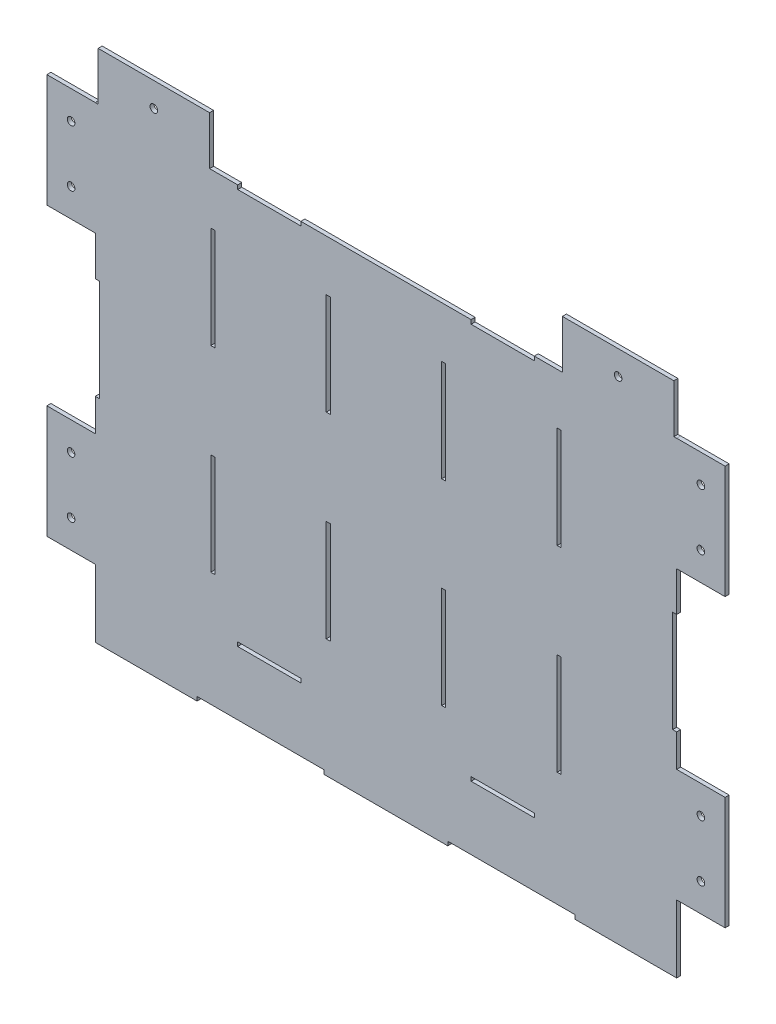
from build123d import *

# Parameters (mm, degrees)
SKETCH1_W                 = 457.223
SKETCH1_H                 = 367.60800004
BOSS_EXTRUDE2_DEPTH       = 3.175
SKETCH4_W                 = 3.175
SKETCH4_H                 = 80
CUT_EXTRUDE1_DEPTH        = 3.175
LPATTERN1_COPY_1_SKETCH_W = 3.175
LPATTERN1_COPY_1_SKETCH_H = 80
LPATTERN1_COPY_1_DEPTH    = 3.175
LPATTERN1_COPY_2_SKETCH_W = 3.175
LPATTERN1_COPY_2_SKETCH_H = 80
LPATTERN1_COPY_2_DEPTH    = 3.175
LPATTERN1_COPY_3_SKETCH_W = 3.175
LPATTERN1_COPY_3_SKETCH_H = 80
LPATTERN1_COPY_3_DEPTH    = 3.175
LPATTERN1_COPY_4_SKETCH_W = 3.175
LPATTERN1_COPY_4_SKETCH_H = 80
LPATTERN1_COPY_4_DEPTH    = 3.175
LPATTERN1_COPY_5_SKETCH_W = 3.175
LPATTERN1_COPY_5_SKETCH_H = 80
LPATTERN1_COPY_5_DEPTH    = 3.175
LPATTERN1_COPY_6_SKETCH_W = 3.175
LPATTERN1_COPY_6_SKETCH_H = 80
LPATTERN1_COPY_6_DEPTH    = 3.175
SKETCH5_W                 = 49.658811606
SKETCH5_H                 = 3.175
CUT_EXTRUDE2_DEPTH        = 3.175
MIRROR3_COPY_1_SKETCH_W   = 49.658811606
MIRROR3_COPY_1_SKETCH_H   = 3.175
MIRROR3_COPY_1_DEPTH      = 3.175
MIRROR3_COPY_2_SKETCH_W   = 49.658811606
MIRROR3_COPY_2_SKETCH_H   = 3.175
MIRROR3_COPY_2_DEPTH      = 3.175
SKETCH6_W                 = 3.175
SKETCH6_H                 = 80
CUT_EXTRUDE3_DEPTH        = 311.705796904
SKETCH7_W                 = 100
SKETCH7_H                 = 3.175
CUT_EXTRUDE4_DEPTH        = 3.175
SKETCH10_W                = 38.099999998
SKETCH10_H                = 88.9
SKETCH10_R                = 3
SKETCH10_W_2              = 38.1
BOSS_EXTRUDE3_DEPTH       = 3.175
SKETCH12_W                = 87.63
SKETCH12_H                = 38.1
SKETCH12_R                = 3
BOSS_EXTRUDE4_DEPTH       = 3.175


with BuildPart() as part:
    # Sketch1 → Boss-Extrude2 (new body)
    with BuildSketch(Plane.XY):
        with Locations((0, -26.588)):
            Rectangle(SKETCH1_W, SKETCH1_H)
    extrude(amount=BOSS_EXTRUDE2_DEPTH)

    # Sketch4 → Cut-Extrude1 (cut)
    with BuildSketch(Plane.XY.offset(3.175)):
        with Locations((-136.213, 77.21600002)):
            Rectangle(SKETCH4_W, SKETCH4_H)
    cut_extrude1 = extrude(amount=-CUT_EXTRUDE1_DEPTH, mode=Mode.SUBTRACT)

    # Mirror1: Cut-Extrude1 across plane
    add(cut_extrude1.mirror(Plane.ZX), mode=Mode.SUBTRACT)

    # LPattern1 copy 1 sketch → LPattern1 copy 1 (cut)
    with BuildSketch(Plane(origin=(90.807, 0, 3.175), x_dir=(1, 0, 0), z_dir=(0, 0, 1))):
        with Locations((-136.213, -77.21600002)):
            Rectangle(LPATTERN1_COPY_1_SKETCH_W, LPATTERN1_COPY_1_SKETCH_H)
    extrude(amount=-LPATTERN1_COPY_1_DEPTH, mode=Mode.SUBTRACT)

    # LPattern1 copy 2 sketch → LPattern1 copy 2 (cut)
    with BuildSketch(Plane(origin=(181.614, 0, 3.175), x_dir=(1, 0, 0), z_dir=(0, 0, 1))):
        with Locations((-136.213, -77.21600002)):
            Rectangle(LPATTERN1_COPY_2_SKETCH_W, LPATTERN1_COPY_2_SKETCH_H)
    extrude(amount=-LPATTERN1_COPY_2_DEPTH, mode=Mode.SUBTRACT)

    # LPattern1 copy 3 sketch → LPattern1 copy 3 (cut)
    with BuildSketch(Plane(origin=(272.421, 0, 3.175), x_dir=(1, 0, 0), z_dir=(0, 0, 1))):
        with Locations((-136.213, -77.21600002)):
            Rectangle(LPATTERN1_COPY_3_SKETCH_W, LPATTERN1_COPY_3_SKETCH_H)
    extrude(amount=-LPATTERN1_COPY_3_DEPTH, mode=Mode.SUBTRACT)

    # LPattern1 copy 4 sketch → LPattern1 copy 4 (cut)
    with BuildSketch(Plane(origin=(90.807, 0, 3.175), x_dir=(1, 0, 0), z_dir=(0, 0, 1))):
        with Locations((-136.213, 77.21600002)):
            Rectangle(LPATTERN1_COPY_4_SKETCH_W, LPATTERN1_COPY_4_SKETCH_H)
    extrude(amount=-LPATTERN1_COPY_4_DEPTH, mode=Mode.SUBTRACT)

    # LPattern1 copy 5 sketch → LPattern1 copy 5 (cut)
    with BuildSketch(Plane(origin=(181.614, 0, 3.175), x_dir=(1, 0, 0), z_dir=(0, 0, 1))):
        with Locations((-136.213, 77.21600002)):
            Rectangle(LPATTERN1_COPY_5_SKETCH_W, LPATTERN1_COPY_5_SKETCH_H)
    extrude(amount=-LPATTERN1_COPY_5_DEPTH, mode=Mode.SUBTRACT)

    # LPattern1 copy 6 sketch → LPattern1 copy 6 (cut)
    with BuildSketch(Plane(origin=(272.421, 0, 3.175), x_dir=(1, 0, 0), z_dir=(0, 0, 1))):
        with Locations((-136.213, 77.21600002)):
            Rectangle(LPATTERN1_COPY_6_SKETCH_W, LPATTERN1_COPY_6_SKETCH_H)
    extrude(amount=-LPATTERN1_COPY_6_DEPTH, mode=Mode.SUBTRACT)

    # Sketch5 → Cut-Extrude2 (cut)
    with BuildSketch(Plane.XY.offset(3.175)):
        with Locations((-91.782094197, -155.62850002)):
            Rectangle(SKETCH5_W, SKETCH5_H)
    cut_extrude2 = extrude(amount=-CUT_EXTRUDE2_DEPTH, mode=Mode.SUBTRACT)

    # Mirror2: Cut-Extrude2 across plane
    add(cut_extrude2.mirror(Plane(origin=(0, 0, 0), x_dir=(0, 0, 1), z_dir=(1, 0, 0))), mode=Mode.SUBTRACT)

    # Mirror3 copy 1 sketch → Mirror3 copy 1 (cut)
    with BuildSketch(Plane(origin=(0, 0, 3.175), x_dir=(-1, 0, 0), z_dir=(0, 0, 1))):
        with Locations((-91.782094197, -155.62850002)):
            Rectangle(MIRROR3_COPY_1_SKETCH_W, MIRROR3_COPY_1_SKETCH_H)
    extrude(amount=-MIRROR3_COPY_1_DEPTH, mode=Mode.SUBTRACT)

    # Mirror3 copy 2 sketch → Mirror3 copy 2 (cut)
    with BuildSketch(Plane.XY.offset(3.175)):
        with Locations((-91.782094197, 155.62850002)):
            Rectangle(MIRROR3_COPY_2_SKETCH_W, MIRROR3_COPY_2_SKETCH_H)
    extrude(amount=-MIRROR3_COPY_2_DEPTH, mode=Mode.SUBTRACT)

    # Sketch6 → Cut-Extrude3 (cut, through all)
    with BuildSketch(Plane.XY.offset(3.175)):
        with Locations((-227.024, -2.78399998)):
            Rectangle(SKETCH6_W, SKETCH6_H)
    cut_extrude3 = extrude(amount=-CUT_EXTRUDE3_DEPTH, mode=Mode.SUBTRACT)

    # Mirror5: Cut-Extrude3 across plane
    add(cut_extrude3.mirror(Plane(origin=(0, 0, 0), x_dir=(0, 0, 1), z_dir=(1, 0, 0))), mode=Mode.SUBTRACT)

    # Sketch7 → Cut-Extrude4 (cut)
    with BuildSketch(Plane.XY.offset(3.175)):
        with Locations((-98.6115, -208.8045)):
            Rectangle(SKETCH7_W, SKETCH7_H)
    cut_extrude4 = extrude(amount=-CUT_EXTRUDE4_DEPTH, mode=Mode.SUBTRACT)

    # Mirror6: Cut-Extrude4 across plane
    add(cut_extrude4.mirror(Plane(origin=(0, 0, 0), x_dir=(0, 0, 1), z_dir=(1, 0, 0))), mode=Mode.SUBTRACT)

    # Sketch10 → Boss-Extrude3 (add)
    # profile 1 of 2: a face of its own
    with BuildSketch(Plane(origin=(0, 0, 0), x_dir=(-1, 0, 0), z_dir=(0, 0, -1))):
        with Locations((-247.6615, 112.823)):
            Rectangle(SKETCH10_W, SKETCH10_H)
        with Locations((-247.6615, 135.048)):
            Circle(SKETCH10_R, mode=Mode.SUBTRACT)
        with Locations((-247.6615, 90.598)):
            Circle(SKETCH10_R, mode=Mode.SUBTRACT)
    # profile 2 of 2: a face of its own
    with BuildSketch(Plane(origin=(0, 0, 0), x_dir=(-1, 0, 0), z_dir=(0, 0, -1))):
        with Locations((-247.6615, -112.76600002)):
            Rectangle(SKETCH10_W_2, SKETCH10_H)
        with Locations((-247.6615, -134.99100002)):
            Circle(SKETCH10_R, mode=Mode.SUBTRACT)
        with Locations((-247.6615, -90.54100002)):
            Circle(SKETCH10_R, mode=Mode.SUBTRACT)
    boss_extrude3 = extrude(amount=-BOSS_EXTRUDE3_DEPTH)

    # Mirror7: Boss-Extrude3 across plane
    add(boss_extrude3.mirror(Plane(origin=(0, 0, 0), x_dir=(0, 0, 1), z_dir=(1, 0, 0))))

    # Sketch12 → Boss-Extrude4 (add)
    with BuildSketch(Plane(origin=(0, 0, 0), x_dir=(-1, 0, 0), z_dir=(0, 0, -1))):
        with Locations((-182.574, 176.26600002)):
            Rectangle(SKETCH12_W, SKETCH12_H)
        with Locations((-182.574, 176.26600002)):
            Circle(SKETCH12_R, mode=Mode.SUBTRACT)
    boss_extrude4 = extrude(amount=-BOSS_EXTRUDE4_DEPTH)

    # Mirror8: Boss-Extrude4 across plane
    add(boss_extrude4.mirror(Plane(origin=(0, 0, 0), x_dir=(0, 0, 1), z_dir=(1, 0, 0))))


solid = part.part
